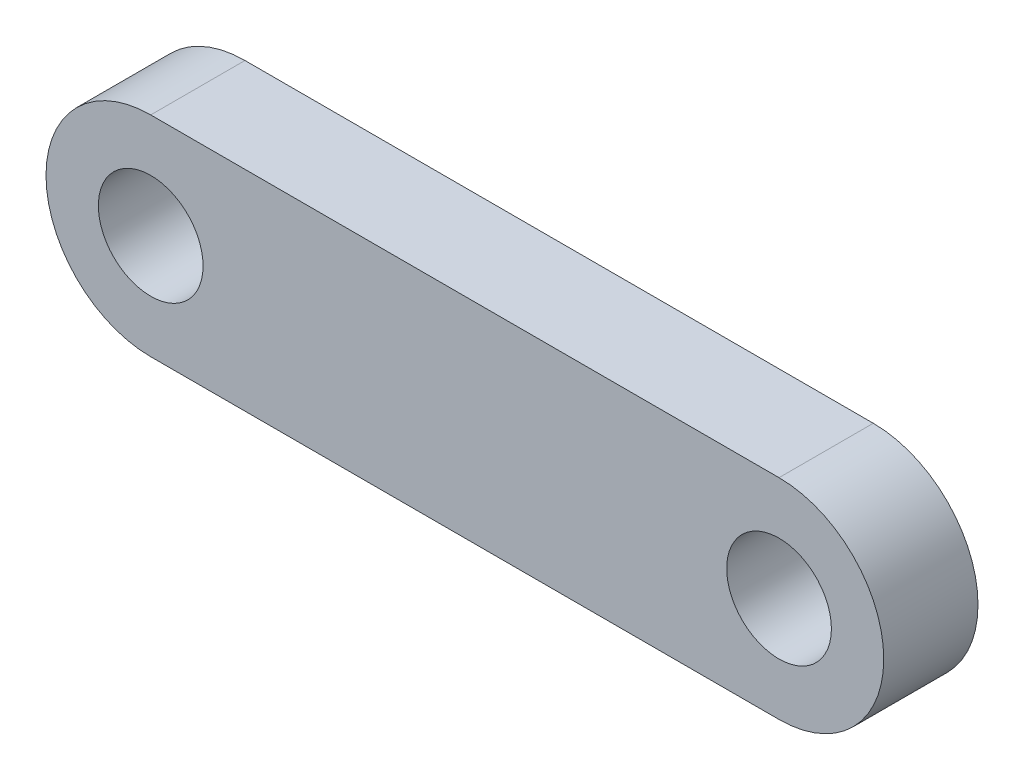
from build123d import *

# Parameters (mm, degrees)
SKETCH1_R           = 5
BOSS_EXTRUDE1_DEPTH = 4.5


with BuildPart() as part:
    # Sketch1 → Boss-Extrude1 (new, symmetric)
    with BuildSketch(Plane.XY):
        with BuildLine():
            Line((-30, 10), (30, 10))
            ThreePointArc((30, 10), (40, 0), (30, -10))
            Line((30, -10), (-30, -10))
            ThreePointArc((-30, -10), (-40, 0), (-30, 10))
        make_face()
        with Locations((-30, 0)):
            Circle(SKETCH1_R, mode=Mode.SUBTRACT)
        with Locations((30, 0)):
            Circle(SKETCH1_R, mode=Mode.SUBTRACT)
    extrude(amount=BOSS_EXTRUDE1_DEPTH, both=True)


solid = part.part
